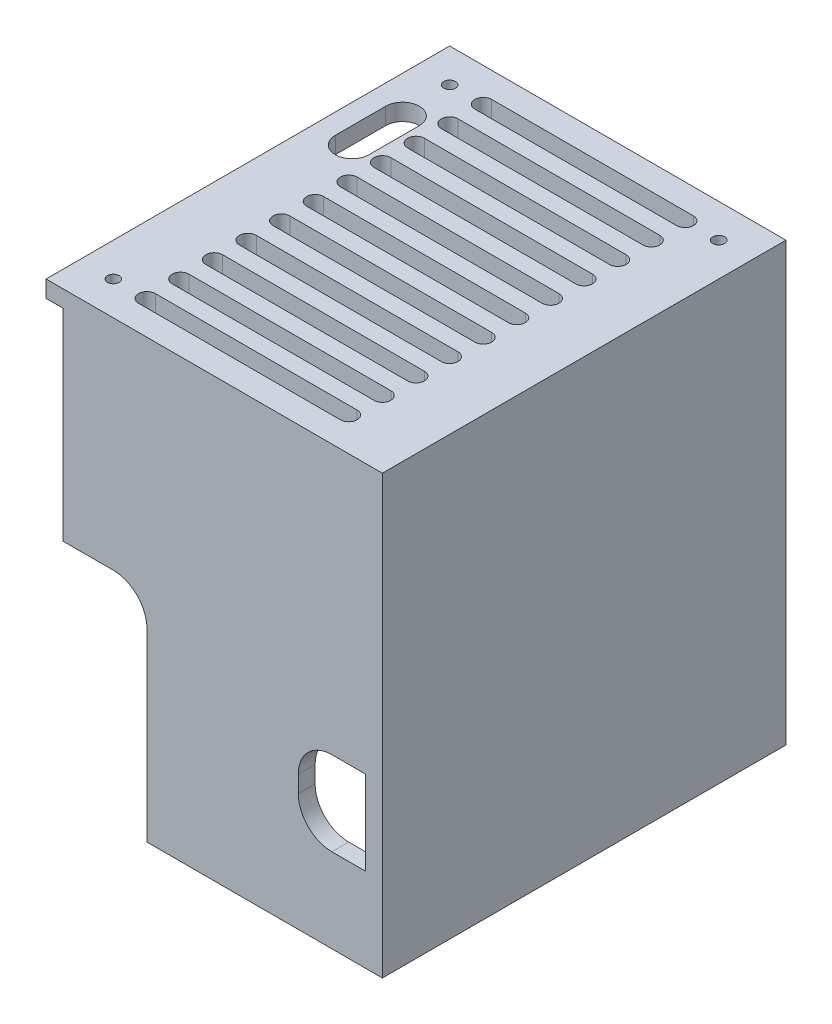
from build123d import *

# Parameters (mm, degrees)
SKETCH2_W           = 100
SKETCH2_H           = 120
BOSS_EXTRUDE1_DEPTH = 5
SKETCH3_W           = 5
SKETCH3_H           = 120
BOSS_EXTRUDE2_DEPTH = 125
SKETCH4_W           = 90
SKETCH4_H           = 5
BOSS_EXTRUDE3_DEPTH = 125
SKETCH5_W           = 10
SKETCH5_H           = 10
BOSS_EXTRUDE4_DEPTH = 15
SKETCH6_R           = 1.45
CUT_EXTRUDE1_DEPTH  = 10
CHAMFER1_SIZE       = 10
CUT_EXTRUDE2_DEPTH  = 10
SKETCH8_W           = 25
SKETCH8_H           = 65
CUT_EXTRUDE3_DEPTH  = 10
SKETCH9_R           = 1.75
CUT_EXTRUDE4_DEPTH  = 10
CUT_EXTRUDE5_DEPTH  = 10
BOSS_EXTRUDE5_START = 20
BOSS_EXTRUDE5_DEPTH = 20
SKETCH12_W          = 1
SKETCH12_H          = 6
CUT_EXTRUDE6_DEPTH  = 40
CHAMFER2_SIZE       = 1
SKETCH13_R          = 2.5
SKETCH13_R_2        = 1.45
BOSS_EXTRUDE6_DEPTH = 3
CHAMFER3_SIZE       = 3
SKETCH14_W          = 20
SKETCH14_H          = 25
CUT_EXTRUDE7_DEPTH  = 10
FILLET1_R           = 10


with BuildPart() as part:
    # Sketch2 → Boss-Extrude1 (new body)
    with BuildSketch(Plane(origin=(0, 0, 0), x_dir=(1, 0, 0), z_dir=(0, 1, 0))):
        with Locations((50, 60)):
            Rectangle(SKETCH2_W, SKETCH2_H)
    extrude(amount=BOSS_EXTRUDE1_DEPTH)

    # Sketch3 → Boss-Extrude2 (add)
    with BuildSketch(Plane.XZ):
        with Locations((97.5, -60)):
            Rectangle(SKETCH3_W, SKETCH3_H)
    extrude(amount=BOSS_EXTRUDE2_DEPTH)

    # Sketch4 → Boss-Extrude3 (add)
    with BuildSketch(Plane.XZ):
        with Locations((50, -2.5)):
            Rectangle(SKETCH4_W, SKETCH4_H)
    extrude(amount=BOSS_EXTRUDE3_DEPTH)

    # Sketch5 → Boss-Extrude4 (add)
    with BuildSketch(Plane.XZ.offset(125)):
        with Locations((90, -10)):
            Rectangle(SKETCH5_W, SKETCH5_H)
        with Locations((90, -110)):
            Rectangle(SKETCH5_W, SKETCH5_H)
    extrude(amount=-BOSS_EXTRUDE4_DEPTH)

    # Sketch6 → Cut-Extrude1 (cut)
    with BuildSketch(Plane.XZ.offset(125)):
        with Locations(Location((90, -10, 0), (0, 0, 270))):
            Circle(SKETCH6_R)
        with Locations(Location((90, -110, 0), (0, 0, 270))):
            Circle(SKETCH6_R)
    extrude(amount=-CUT_EXTRUDE1_DEPTH, mode=Mode.SUBTRACT)

    # Chamfer1
    chamfer1_edges = [part.edges().sort_by_distance(p)[0] for p in [
        (95, -110, -110),
        (95, -110, -10),
    ]]
    chamfer(chamfer1_edges, length=CHAMFER1_SIZE - 0.0001)  # a hair under: the kernel refuses the full size

    # Sketch7 → Cut-Extrude2 (cut)
    with BuildSketch(Plane.XZ):
        with BuildLine():
            Line((20, -7.5), (80, -7.5))
            ThreePointArc((80, -7.5), (82.5, -10), (80, -12.5))
            Line((80, -12.5), (20, -12.5))
            ThreePointArc((20, -12.5), (17.5, -10), (20, -7.5))
        make_face()
        with BuildLine():
            Line((20, -17.5), (80, -17.5))
            ThreePointArc((80, -17.5), (82.5, -20), (80, -22.5))
            Line((80, -22.5), (20, -22.5))
            ThreePointArc((20, -22.5), (17.5, -20), (20, -17.5))
        make_face()
        with BuildLine():
            Line((20, -27.5), (80, -27.5))
            ThreePointArc((80, -27.5), (82.5, -30), (80, -32.5))
            Line((80, -32.5), (20, -32.5))
            ThreePointArc((20, -32.5), (17.5, -30), (20, -27.5))
        make_face()
        with BuildLine():
            Line((20, -37.5), (80, -37.5))
            ThreePointArc((80, -37.5), (82.5, -40), (80, -42.5))
            Line((80, -42.5), (20, -42.5))
            ThreePointArc((20, -42.5), (17.5, -40), (20, -37.5))
        make_face()
        with BuildLine():
            Line((20, -47.5), (80, -47.5))
            ThreePointArc((80, -47.5), (82.5, -50), (80, -52.5))
            Line((80, -52.5), (20, -52.5))
            ThreePointArc((20, -52.5), (17.5, -50), (20, -47.5))
        make_face()
        with BuildLine():
            Line((20, -57.5), (80, -57.5))
            ThreePointArc((80, -57.5), (82.5, -60), (80, -62.5))
            Line((80, -62.5), (20, -62.5))
            ThreePointArc((20, -62.5), (17.5, -60), (20, -57.5))
        make_face()
        with BuildLine():
            Line((20, -67.5), (80, -67.5))
            ThreePointArc((80, -67.5), (82.5, -70), (80, -72.5))
            Line((80, -72.5), (20, -72.5))
            ThreePointArc((20, -72.5), (17.5, -70), (20, -67.5))
        make_face()
        with BuildLine():
            Line((20, -77.5), (80, -77.5))
            ThreePointArc((80, -77.5), (82.5, -80), (80, -82.5))
            Line((80, -82.5), (20, -82.5))
            ThreePointArc((20, -82.5), (17.5, -80), (20, -77.5))
        make_face()
        with BuildLine():
            Line((20, -87.5), (80, -87.5))
            ThreePointArc((80, -87.5), (82.5, -90), (80, -92.5))
            Line((80, -92.5), (20, -92.5))
            ThreePointArc((20, -92.5), (17.5, -90), (20, -87.5))
        make_face()
        with BuildLine():
            Line((20, -97.5), (80, -97.5))
            ThreePointArc((80, -97.5), (82.5, -100), (80, -102.5))
            Line((80, -102.5), (20, -102.5))
            ThreePointArc((20, -102.5), (17.5, -100), (20, -97.5))
        make_face()
        with BuildLine():
            Line((20, -107.5), (80, -107.5))
            ThreePointArc((80, -107.5), (82.5, -110), (80, -112.5))
            Line((80, -112.5), (20, -112.5))
            ThreePointArc((20, -112.5), (17.5, -110), (20, -107.5))
        make_face()
    extrude(amount=-CUT_EXTRUDE2_DEPTH, mode=Mode.SUBTRACT)

    # Sketch8 → Cut-Extrude3 (cut)
    with BuildSketch(Plane.XY):
        with Locations((17.5, -92.5)):
            Rectangle(SKETCH8_W, SKETCH8_H)
    extrude(amount=-CUT_EXTRUDE3_DEPTH, mode=Mode.SUBTRACT)

    # Sketch9 → Cut-Extrude4 (cut)
    with BuildSketch(Plane.XZ):
        with Locations(Location((10, -110, 0), (0, 0, 270))):
            Circle(SKETCH9_R)
        with Locations(Location((10, -10, 0), (0, 0, 270))):
            Circle(SKETCH9_R)
        with Locations(Location((90, -110, 0), (0, 0, 270))):
            Circle(SKETCH9_R)
    extrude(amount=-CUT_EXTRUDE4_DEPTH, mode=Mode.SUBTRACT)

    # Sketch10 → Cut-Extrude5 (cut)
    with BuildSketch(Plane.XZ):
        with BuildLine():
            Line((6, -95), (6, -80))
            ThreePointArc((6, -80), (11, -75), (16, -80))
            Line((16, -80), (16, -95))
            ThreePointArc((16, -95), (11, -100), (6, -95))
        make_face()
    extrude(amount=-CUT_EXTRUDE5_DEPTH, mode=Mode.SUBTRACT)

    # Sketch11 → Boss-Extrude5 (add)
    with BuildSketch(Plane.XZ.offset(BOSS_EXTRUDE5_START)):
        with BuildLine():
            ThreePointArc((6, -80), (11, -71.923580655), (16, -80))
            ThreePointArc((16, -80), (11, -75), (6, -80))
        make_face()
    extrude(amount=-BOSS_EXTRUDE5_DEPTH)

    # Sketch12 → Cut-Extrude6 (cut)
    with BuildSketch(Plane(origin=(0, 0, 0), x_dir=(0, 0, -1), z_dir=(1, 0, 0))):
        with Locations((72.423580655, -10)):
            Rectangle(SKETCH12_W, SKETCH12_H)
    extrude(amount=CUT_EXTRUDE6_DEPTH, mode=Mode.SUBTRACT)

    # Chamfer2
    chamfer2_edges = [part.edges().sort_by_distance(p)[0] for p in [
        (11, -13, -72.923580655),
        (11, -7, -72.923580655),
    ]]
    chamfer(chamfer2_edges, length=CHAMFER2_SIZE - 0.0001)  # a hair under: the kernel refuses the full size

    # Sketch13 → Boss-Extrude6 (add)
    # profile 1 of 4: a face of its own
    with BuildSketch(Plane.ZY.offset(-95)):
        with Locations(Location((-97.9, -110.9, 0), (0, 0, 180))):
            Circle(SKETCH13_R)
        with Locations((-97.9, -110.9)):
            Circle(SKETCH13_R_2, mode=Mode.SUBTRACT)
    # profile 2 of 4: a face of its own
    with BuildSketch(Plane.ZY.offset(-95)):
        with Locations(Location((-97.9, -9.1, 0), (0, 0, 180))):
            Circle(SKETCH13_R)
        with Locations((-97.9, -9.1)):
            Circle(SKETCH13_R_2, mode=Mode.SUBTRACT)
    # profile 3 of 4: a face of its own
    with BuildSketch(Plane.ZY.offset(-95)):
        with Locations(Location((-22.1, -9.1, 0), (0, 0, 180))):
            Circle(SKETCH13_R)
        with Locations((-22.1, -9.1)):
            Circle(SKETCH13_R_2, mode=Mode.SUBTRACT)
    # profile 4 of 4: a face of its own
    with BuildSketch(Plane.ZY.offset(-95)):
        with Locations(Location((-22.1, -110.9, 0), (0, 0, 180))):
            Circle(SKETCH13_R)
        with Locations((-22.1, -110.9)):
            Circle(SKETCH13_R_2, mode=Mode.SUBTRACT)
    extrude(amount=BOSS_EXTRUDE6_DEPTH)

    # Chamfer3
    chamfer3_edges = [part.edges().sort_by_distance(p)[0] for p in [
        (95, -110.9, -95.4),
        (95, -9.1, -95.4),
        (95, -9.1, -19.6),
        (95, -110.9, -19.6),
    ]]
    chamfer(chamfer3_edges, length=CHAMFER3_SIZE - 0.0001)  # a hair under: the kernel refuses the full size

    # Sketch14 → Cut-Extrude7 (cut)
    with BuildSketch(Plane(origin=(0, 0, -5), x_dir=(-1, 0, 0), z_dir=(0, 0, -1))):
        with Locations((-85, -87.5)):
            Rectangle(SKETCH14_W, SKETCH14_H)
    extrude(amount=-CUT_EXTRUDE7_DEPTH, mode=Mode.SUBTRACT)

    # Fillet1
    fillet1_edges = [part.edges().sort_by_distance(p)[0] for p in [
        (30, -60, -2.5),
        (75, -75, -2.5),
        (75, -100, -2.5),
    ]]
    fillet(fillet1_edges, radius=FILLET1_R)


solid = part.part
